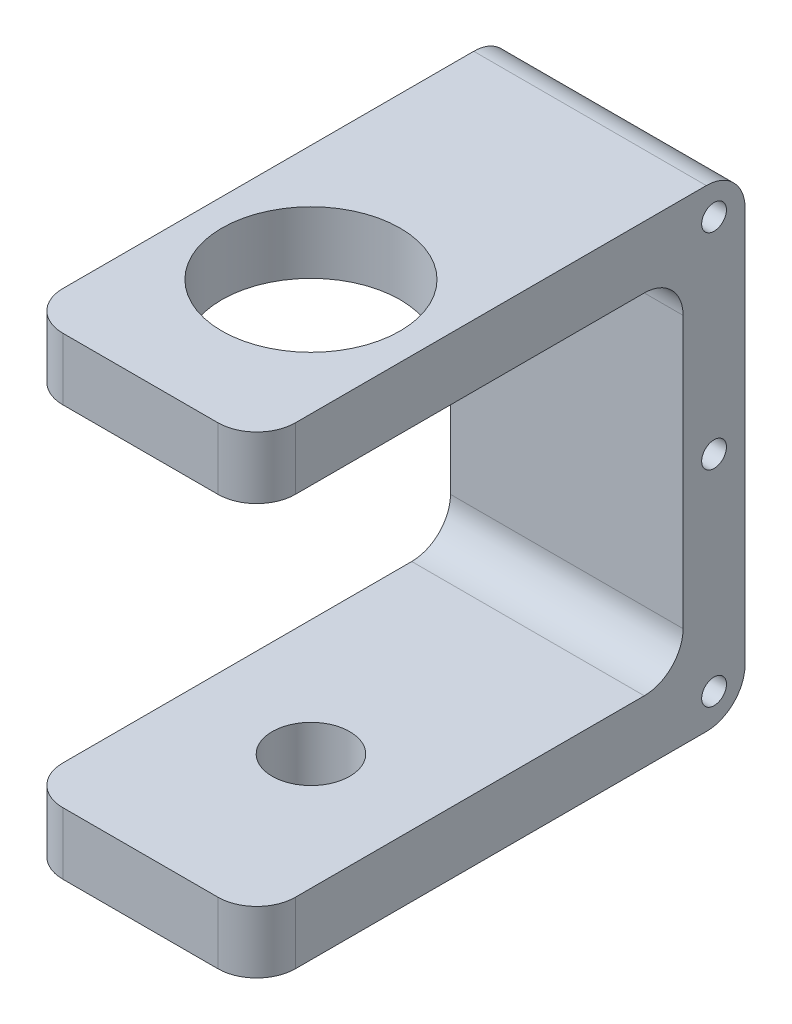
from build123d import *

# Parameters (mm, degrees)
BOSS_EXTRUDE1_DEPTH = 30
CUT_EXTRUDE1_REACH  = 94.682
SKETCH2_R           = 11.5
CUT_EXTRUDE2_REACH  = 89.624
SKETCH3_R           = 5
CUT_EXTRUDE3_REACH  = 89.624
SKETCH4_R           = 1.6
FILLET1_R           = 5
FILLET2_R           = 5


with BuildPart() as part:
    # Sketch1 → Boss-Extrude1 (new body)
    with BuildSketch(Plane(origin=(0, 0, 0), x_dir=(0, 0, -1), z_dir=(1, 0, 0))):
        Polygon((0, 0), (55, 0), (55, -45), (0, -45), (0, -53), (63, -53), (63, 8), (0, 8), align=None)
    extrude(amount=BOSS_EXTRUDE1_DEPTH)

    # Sketch2 → Cut-Extrude1 (cut, up to next)
    with BuildSketch(Plane(origin=(0, 8, 0), x_dir=(1, 0, 0), z_dir=(0, 1, 0)), mode=Mode.PRIVATE) as cut_extrude1_sk1:
        with Locations((15, 22)):
            Circle(SKETCH2_R)
    cut_extrude1_tool1 = extrude(cut_extrude1_sk1.sketch, amount=-CUT_EXTRUDE1_REACH, mode=Mode.PRIVATE) & part.part
    add(cut_extrude1_tool1.solids().sort_by_distance((15, 8, -22))[0], mode=Mode.SUBTRACT)

    # Sketch3 → Cut-Extrude2 (cut, up to next)
    with BuildSketch(Plane(origin=(0, -45, 0), x_dir=(1, 0, 0), z_dir=(0, 1, 0)), mode=Mode.PRIVATE) as cut_extrude2_sk1:
        with Locations((15, 22)):
            Circle(SKETCH3_R)
    cut_extrude2_tool1 = extrude(cut_extrude2_sk1.sketch, amount=-CUT_EXTRUDE2_REACH, mode=Mode.PRIVATE) & part.part
    add(cut_extrude2_tool1.solids().sort_by_distance((15, -45, -22))[0], mode=Mode.SUBTRACT)

    # Sketch4 → Cut-Extrude3 (cut, up to next)
    with BuildSketch(Plane(origin=(30, 0, 0), x_dir=(0, 0, -1), z_dir=(1, 0, 0)), mode=Mode.PRIVATE) as cut_extrude3_sk1:
        with Locations((59, 4)):
            Circle(SKETCH4_R)
    cut_extrude3_tool1 = extrude(cut_extrude3_sk1.sketch, amount=-CUT_EXTRUDE3_REACH, mode=Mode.PRIVATE) & part.part
    # Sketch4 → Cut-Extrude3 (cut, up to next)
    with BuildSketch(Plane(origin=(30, 0, 0), x_dir=(0, 0, -1), z_dir=(1, 0, 0)), mode=Mode.PRIVATE) as cut_extrude3_sk2:
        with Locations((59, -49)):
            Circle(SKETCH4_R)
    cut_extrude3_tool2 = extrude(cut_extrude3_sk2.sketch, amount=-CUT_EXTRUDE3_REACH, mode=Mode.PRIVATE) & part.part
    # Sketch4 → Cut-Extrude3 (cut, up to next)
    with BuildSketch(Plane(origin=(30, 0, 0), x_dir=(0, 0, -1), z_dir=(1, 0, 0)), mode=Mode.PRIVATE) as cut_extrude3_sk3:
        with Locations((59, -22.5)):
            Circle(SKETCH4_R)
    cut_extrude3_tool3 = extrude(cut_extrude3_sk3.sketch, amount=-CUT_EXTRUDE3_REACH, mode=Mode.PRIVATE) & part.part
    add(cut_extrude3_tool1.solids().sort_by_distance((30, 4, -59))[0], mode=Mode.SUBTRACT)
    add(cut_extrude3_tool2.solids().sort_by_distance((30, -49, -59))[0], mode=Mode.SUBTRACT)
    add(cut_extrude3_tool3.solids().sort_by_distance((30, -22.5, -59))[0], mode=Mode.SUBTRACT)

    # Fillet1
    fillet1_edges = [part.edges().sort_by_distance(p)[0] for p in [
        (15, -53, -63),
        (15, 8, -63),
        (0, -49, 0),
        (0, 4, 0),
        (30, -49, 0),
        (30, 4, 0),
    ]]
    fillet(fillet1_edges, radius=FILLET1_R)

    # Fillet2
    fillet2_edges = [part.edges().sort_by_distance(p)[0] for p in [
        (15, 0, -55),
        (15, -45, -55),
    ]]
    fillet(fillet2_edges, radius=FILLET2_R)


solid = part.part
